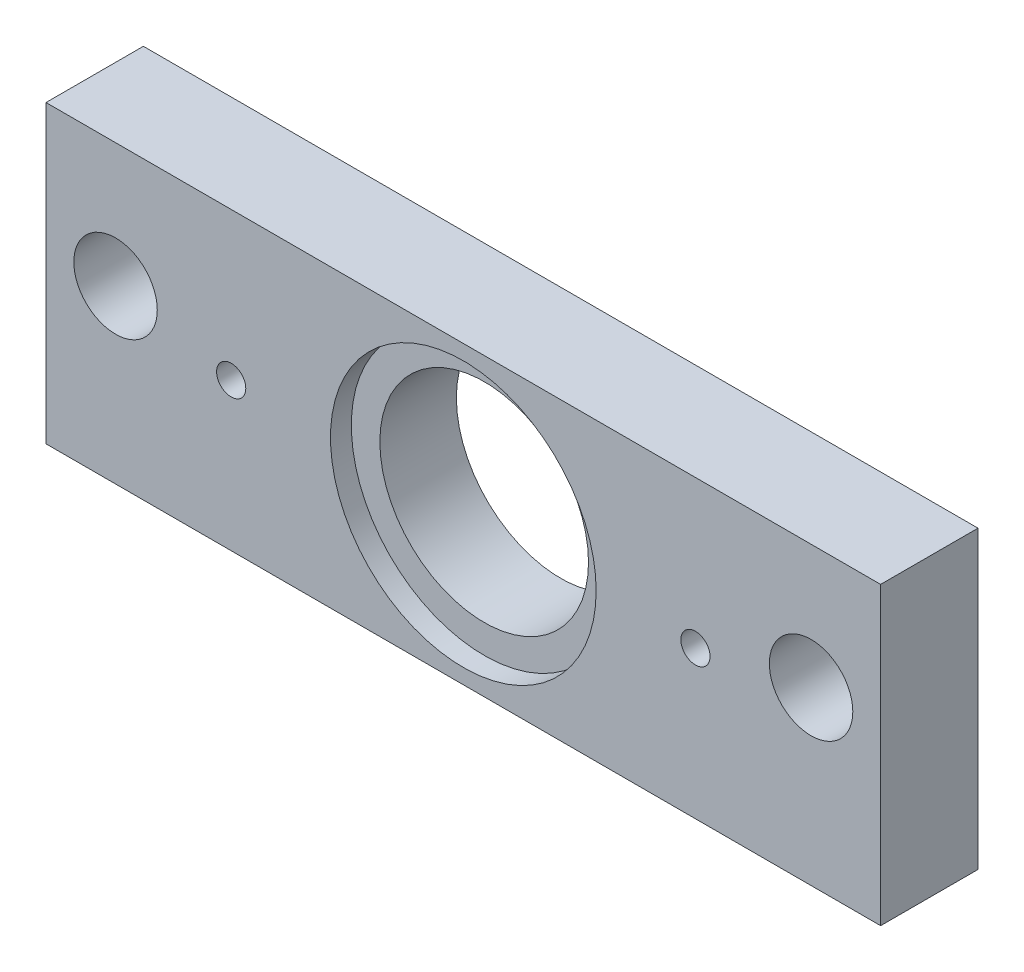
from build123d import *

# Parameters (mm, degrees)
SKETCH1_W           = 120
SKETCH1_H           = 42.5
BOSS_EXTRUDE1_DEPTH = 7
SKETCH2_R           = 19.1
CUT_EXTRUDE1_DEPTH  = 3
SKETCH3_R           = 15
CUT_EXTRUDE2_DEPTH  = 65.595375221
SKETCH4_R           = 2.1
CUT_EXTRUDE3_DEPTH  = 66.173326599
SKETCH5_R           = 6
CUT_EXTRUDE4_DEPTH  = 66.173326599
SKETCH6_R           = 2.1
SKETCH6_R_2         = 1.25
CUT_EXTRUDE5_DEPTH  = 10


with BuildPart() as part:
    # Sketch1 → Boss-Extrude1 (new, symmetric)
    with BuildSketch(Plane.XY):
        Rectangle(SKETCH1_W, SKETCH1_H)
    extrude(amount=BOSS_EXTRUDE1_DEPTH, both=True)

    # Sketch2 → Cut-Extrude1 (cut)
    with BuildSketch(Plane.XY.offset(7)):
        Circle(SKETCH2_R)
    extrude(amount=-CUT_EXTRUDE1_DEPTH, mode=Mode.SUBTRACT)

    # Sketch3 → Cut-Extrude2 (cut, through all)
    with BuildSketch(Plane.XY.offset(4)):
        Circle(SKETCH3_R)
    extrude(amount=-CUT_EXTRUDE2_DEPTH, mode=Mode.SUBTRACT)

    # Sketch4 → Cut-Extrude3 (cut, through all)
    with BuildSketch(Plane.XY.offset(7)):
        with Locations((-33.375, 0)):
            Circle(SKETCH4_R)
        with Locations((33.375, 0)):
            Circle(SKETCH4_R)
    extrude(amount=-CUT_EXTRUDE3_DEPTH, mode=Mode.SUBTRACT)

    # Sketch5 → Cut-Extrude4 (cut, through all)
    with BuildSketch(Plane.XY.offset(7)):
        with Locations((-50, 3.4)):
            Circle(SKETCH5_R)
        with Locations((50, 3.4)):
            Circle(SKETCH5_R)
    extrude(amount=-CUT_EXTRUDE4_DEPTH, mode=Mode.SUBTRACT)

    # Sketch6 → Cut-Extrude5 (cut)
    with BuildSketch(Plane.XZ.offset(21.25)):
        with Locations((-50, 0)):
            Circle(SKETCH6_R)
        with Locations((-25, 0)):
            Circle(SKETCH6_R)
        with Locations((25, 0)):
            Circle(SKETCH6_R)
        with Locations((50, 0)):
            Circle(SKETCH6_R)
        with Locations((-37.5, 0)):
            Circle(SKETCH6_R_2)
        with Locations((37.5, 0)):
            Circle(SKETCH6_R_2)
    extrude(amount=-CUT_EXTRUDE5_DEPTH, mode=Mode.SUBTRACT)


solid = part.part
